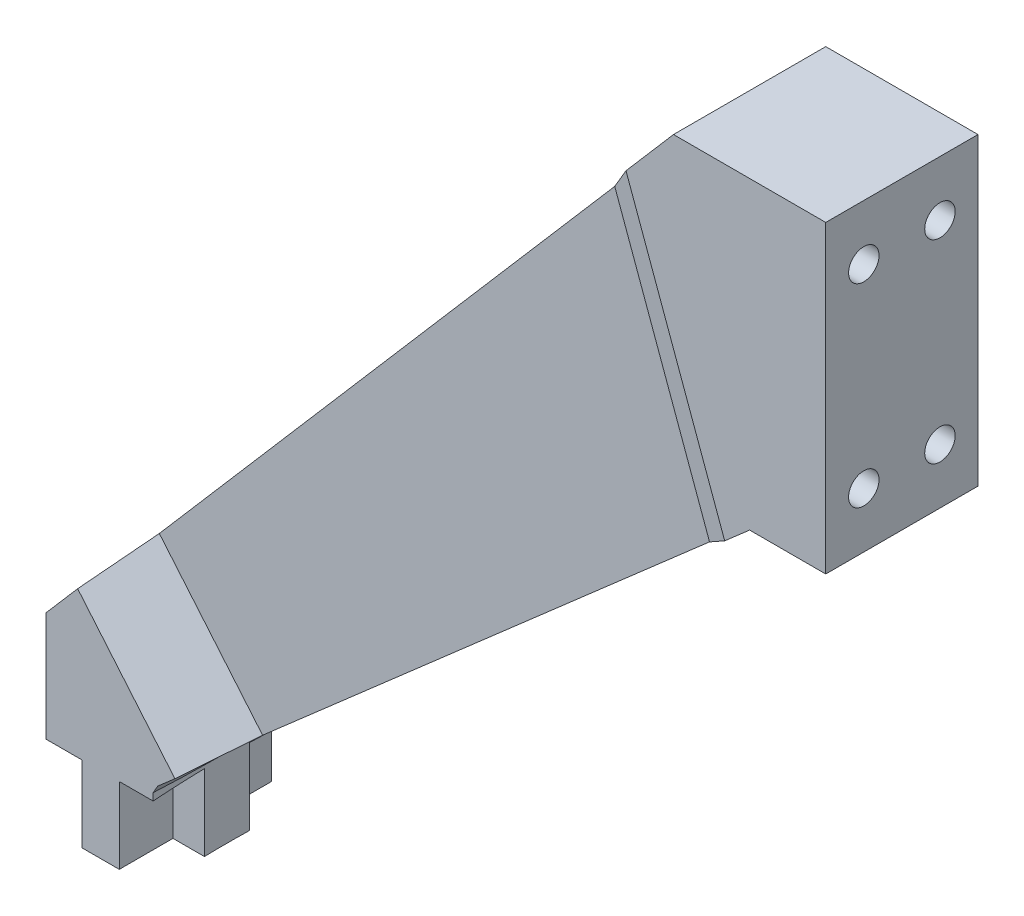
from build123d import *

# Parameters (mm, degrees)
BOSS_EXTRUDE1_DEPTH        = 10
SKETCH2_W                  = 5.05
SKETCH2_H                  = 7.05
CUT_EXTRUDE6_DEPTH         = 10
CUT_EXTRUDE7_DEPTH         = 5
CHAMFER2_SIZE              = 5.196152423
CHAMFER2_SIZE_2            = 9
CHAMFER2_OF_MIRROR4_SIZE   = 5.196152423
CHAMFER2_OF_MIRROR4_SIZE_2 = 9
SKETCH5_R                  = 2
CUT_EXTRUDE5_DEPTH         = 6
CUT_EXTRUDE8_START         = -120
CUT_EXTRUDE8_DEPTH         = 24.374622763
SKETCH8_R                  = 144.95
CUT_EXTRUDE9_DEPTH         = 12
BOSS_EXTRUDE2_DEPTH        = 20
SKETCH12_R                 = 2
CUT_EXTRUDE10_DEPTH        = 6
BOSS_EXTRUDE3_START        = -21
SKETCH13_W                 = 31.497171345
SKETCH13_H                 = 26
BOSS_EXTRUDE3_DEPTH        = 4
CHAMFER3_SIZE              = 15


# Read off the part's stored shape, not the designer's step: Cut-Extrude8
with BuildPart() as part:
    # Sketch1 → Boss-Extrude1 (new, symmetric)
    with BuildSketch(Plane.XY):
        Polygon((0, 120), (0, 80), (-10, 80), (-87.75, 12), (-87.75, 0), (-102.75, 0), (-102.75, 24), (-20, 120), align=None)
    extrude(amount=BOSS_EXTRUDE1_DEPTH, both=True)

    # Sketch2 → Cut-Extrude6 (cut)
    with BuildSketch(Plane.XZ):
        with Locations((-100.225, 6.475)):
            Rectangle(SKETCH2_W, SKETCH2_H)
        with Locations((-90.275, 6.475)):
            Rectangle(SKETCH2_W, SKETCH2_H)
        with Locations((-90.275, -6.475)):
            Rectangle(SKETCH2_W, SKETCH2_H)
        with Locations((-100.225, -6.475)):
            Rectangle(SKETCH2_W, SKETCH2_H)
    extrude(amount=-CUT_EXTRUDE6_DEPTH, mode=Mode.SUBTRACT)

    # Sketch6 → Cut-Extrude7 (cut)
    with BuildSketch(Plane.XY.offset(10)):
        Polygon((-98.494242528, 28.937192959), (-85.75, 13.749196141), (-13, 77.376205788), (-25.986145629, 113.055347669), align=None)
    cut_extrude7 = extrude(amount=-CUT_EXTRUDE7_DEPTH, mode=Mode.SUBTRACT)

    # Chamfer2
    # the kernel refuses this chamfer: 9, 5.196152423 mm, written as the material it adds along each edge
    with BuildSketch(Plane(origin=(-5.036481035, 55.496617251, 5), x_dir=(0.05440243528858507, 0.019800867116638043, 0.9983227437537925), z_dir=(-0.342020143325666, 0.9396926207859094, 0))) as chamfer2_piece_1_section:
        Polygon((CHAMFER2_SIZE * 0.998322743697, -CHAMFER2_SIZE * 0.0578938623994), (-CHAMFER2_SIZE_2 * 0.0578938624027, -CHAMFER2_SIZE_2 * 0.998322743754), (0, 0), align=None)
    chamfer2_piece_1 = extrude(amount=84.536493315, mode=Mode.PRIVATE)
    chamfer2_piece_1 = split(chamfer2_piece_1, bisect_by=Plane(origin=(-21.83844233, 92.842389445, 10), z_dir=(0, 0, -1)), keep=Keep.TOP, mode=Mode.PRIVATE)
    chamfer2_piece_1 = split(chamfer2_piece_1, bisect_by=Plane(origin=(-34.214088998, 103.509939047, 6.650101228), z_dir=(0.7574435982041207, -0.6529006015769894, 0)), keep=Keep.TOP, mode=Mode.PRIVATE)
    chamfer2_piece_1 = split(chamfer2_piece_1, bisect_by=Plane(origin=(-10.343648825, 79.699445401, 6.650101228), z_dir=(-0.6583332390976693, 0.7527266079388791, 0)), keep=Keep.TOP, mode=Mode.PRIVATE)
    add(chamfer2_piece_1)
    with BuildSketch(Plane(origin=(-113.460762542, 46.773596955, 5), x_dir=(-0.04434927158426045, -0.03721345742933334, 0.9983227437537927), z_dir=(0.642787609686533, -0.7660444431189835, 0))) as chamfer2_piece_2_section:
        Polygon((CHAMFER2_SIZE * 0.998322743697, -CHAMFER2_SIZE * 0.0578938623994), (-CHAMFER2_SIZE_2 * 0.0578938624027, -CHAMFER2_SIZE_2 * 0.998322743754), (0, 0), align=None)
    chamfer2_piece_2 = extrude(amount=66.394065339, mode=Mode.PRIVATE)
    chamfer2_piece_2 = split(chamfer2_piece_2, bisect_by=Plane(origin=(-97.520772346, 30.066536009, 6.631431033), z_dir=(0.7574435982041207, -0.6529006015769894, 0)), keep=Keep.TOP, mode=Mode.PRIVATE)
    chamfer2_piece_2 = split(chamfer2_piece_2, bisect_by=Plane(origin=(-83.277010041, 15.912068389, 6.631431033), z_dir=(-0.6583332390976693, 0.7527266079388791, 0)), keep=Keep.TOP, mode=Mode.PRIVATE)
    chamfer2_piece_2 = split(chamfer2_piece_2, bisect_by=Plane(origin=(-89.945880011, 23.537136627, 10), z_dir=(0, 0, -1)), keep=Keep.TOP, mode=Mode.PRIVATE)
    add(chamfer2_piece_2)

    # Mirror4: Cut-Extrude7 across plane
    add(cut_extrude7.mirror(Plane.XY), mode=Mode.SUBTRACT)

    # Chamfer2 of Mirror4
    # the kernel refuses this chamfer: 9, 5.196152423 mm, written as the material it adds along each edge
    with BuildSketch(Plane(origin=(-5.036481035, 55.496617251, -5), x_dir=(0.05440243528858507, 0.019800867116638043, -0.9983227437537925), z_dir=(-0.342020143325666, 0.9396926207859094, 0))) as chamfer2_of_mirror4_piece_1_section:
        Polygon((CHAMFER2_OF_MIRROR4_SIZE * 0.998322743697, CHAMFER2_OF_MIRROR4_SIZE * 0.0578938623994), (-CHAMFER2_OF_MIRROR4_SIZE_2 * 0.0578938624027, CHAMFER2_OF_MIRROR4_SIZE_2 * 0.998322743754), (0, 0), align=None)
    chamfer2_of_mirror4_piece_1 = extrude(amount=84.536493315, mode=Mode.PRIVATE)
    chamfer2_of_mirror4_piece_1 = split(chamfer2_of_mirror4_piece_1, bisect_by=Plane(origin=(-34.214088998, 103.509939047, -6.650101228), z_dir=(0.7574435982040639, -0.6529006015770552, 0)), keep=Keep.TOP, mode=Mode.PRIVATE)
    chamfer2_of_mirror4_piece_1 = split(chamfer2_of_mirror4_piece_1, bisect_by=Plane(origin=(-10.343648825, 79.699445401, -6.650101228), z_dir=(-0.6583332390977968, 0.7527266079387677, 0)), keep=Keep.TOP, mode=Mode.PRIVATE)
    chamfer2_of_mirror4_piece_1 = split(chamfer2_of_mirror4_piece_1, bisect_by=Plane(origin=(-21.83844233, 92.842389445, -10), z_dir=(0, 0, 1)), keep=Keep.TOP, mode=Mode.PRIVATE)
    add(chamfer2_of_mirror4_piece_1)
    with BuildSketch(Plane(origin=(-113.460762542, 46.773596955, -5), x_dir=(0.7659013618145366, 0.6426675502167433, 0.019326765612700778), z_dir=(0.642787609686533, -0.7660444431189835, 0))) as chamfer2_of_mirror4_piece_2_section:
        Polygon((CHAMFER2_OF_MIRROR4_SIZE_2 * 0.999813220622, -CHAMFER2_OF_MIRROR4_SIZE_2 * 0.0193267656127), (-CHAMFER2_OF_MIRROR4_SIZE * 0.0193267656116, -CHAMFER2_OF_MIRROR4_SIZE * 0.999813220566), (0, 0), align=None)
    chamfer2_of_mirror4_piece_2 = extrude(amount=66.394065339, mode=Mode.PRIVATE)
    chamfer2_of_mirror4_piece_2 = split(chamfer2_of_mirror4_piece_2, bisect_by=Plane(origin=(-97.520772346, 30.066536009, -6.631431033), z_dir=(0.7574435982040639, -0.6529006015770552, 0)), keep=Keep.TOP, mode=Mode.PRIVATE)
    chamfer2_of_mirror4_piece_2 = split(chamfer2_of_mirror4_piece_2, bisect_by=Plane(origin=(-83.277010041, 15.912068389, -6.631431033), z_dir=(-0.6583332390977968, 0.7527266079387677, 0)), keep=Keep.TOP, mode=Mode.PRIVATE)
    chamfer2_of_mirror4_piece_2 = split(chamfer2_of_mirror4_piece_2, bisect_by=Plane(origin=(-89.945880011, 23.537136627, -10), z_dir=(0, 0, 1)), keep=Keep.TOP, mode=Mode.PRIVATE)
    add(chamfer2_of_mirror4_piece_2)

    # Sketch5 → Cut-Extrude5 (cut)
    with BuildSketch(Plane(origin=(0, 0, 0), x_dir=(0, 0, -1), z_dir=(1, 0, 0))):
        with Locations((-5, 112.75)):
            Circle(SKETCH5_R)
        with Locations((-5, 87.25)):
            Circle(SKETCH5_R)
        with Locations(Location((5, 87.25, 0), (0, 0, 180))):
            Circle(SKETCH5_R)
        with Locations(Location((5, 112.75, 0), (0, 0, 180))):
            Circle(SKETCH5_R)
    extrude(amount=-CUT_EXTRUDE5_DEPTH, mode=Mode.SUBTRACT)

    # Cut-Extrude8 outline → Cut-Extrude8 (cut)
    with BuildSketch(Plane(origin=(0, 120, 0), x_dir=(1, 0, 0), z_dir=(0, 1, 0)).offset(CUT_EXTRUDE8_START)):
        with BuildLine():
            Line((-102.75, 7.56e-07), (-102.75, -10))
            Line((-102.75, -10), (-102.427082983, -10))
            ThreePointArc((-102.427082983, -10), (-102.669249724, -5.002605828), (-102.75, 7.56e-07))
        make_face()
        with BuildLine():
            Line((-102.427082983, 10), (-102.75, 10))
            Line((-102.75, 10), (-102.75, 7.56e-07))
            ThreePointArc((-102.75, 7.56e-07), (-102.669249699, 5.002606583), (-102.427082983, 10))
        make_face()
    extrude(amount=CUT_EXTRUDE8_DEPTH, mode=Mode.SUBTRACT)

    # Sketch8 → Cut-Extrude9 (cut)
    with BuildSketch(Plane.XZ):
        with Locations((56.25, 0)):
            Circle(SKETCH8_R)
    extrude(amount=-CUT_EXTRUDE9_DEPTH, mode=Mode.SUBTRACT)

    # Sketch10 → Boss-Extrude2 (add)
    with BuildSketch(Plane(origin=(0, 0, -10), x_dir=(-1, 0, 0), z_dir=(0, 0, -1))):
        Polygon((87.75, 12), (88.771540348, 10.230640215), (90.560927794, 10.230640215), (90.560927794, 12), align=None)
    extrude(amount=-BOSS_EXTRUDE2_DEPTH)

    # Sketch12 → Cut-Extrude10 (cut)
    with BuildSketch(Plane(origin=(-70.818661801, 61.044211083, 0), x_dir=(0, 0, 1), z_dir=(-0.7574435982041208, 0.6529006015769894, 0))):
        with Locations(Location((-4.797171345, 71.964164649, 0), (0, 0, 270))):
            Circle(SKETCH12_R)
        with Locations(Location((4.797171345, 71.964164649, 0), (0, 0, 90))):
            Circle(SKETCH12_R)
        with Locations(Location((4.797171345, -43.035835351, 0), (0, 0, 270))):
            Circle(SKETCH12_R)
        with Locations(Location((-4.797171345, -43.035835351, 0), (0, 0, 90))):
            Circle(SKETCH12_R)
    extrude(amount=-CUT_EXTRUDE10_DEPTH, mode=Mode.SUBTRACT)

    # Sketch13 → Boss-Extrude3 (add)
    with BuildSketch(Plane(origin=(-70.818661801, 61.044211083, 0), x_dir=(0, 0, 1), z_dir=(-0.7574435982041208, 0.6529006015769894, 0)).offset(BOSS_EXTRUDE3_START)):
        with Locations((-20.748585673, -19.175835351)):
            Rectangle(SKETCH13_W, SKETCH13_H)
    extrude(amount=BOSS_EXTRUDE3_DEPTH)

    # Chamfer3
    chamfer3_edges = [part.edges().sort_by_distance(p)[0] for p in [
        (-70.462035068, 35.42028713, -5),
    ]]
    chamfer(chamfer3_edges, length=CHAMFER3_SIZE)


solid = part.part
